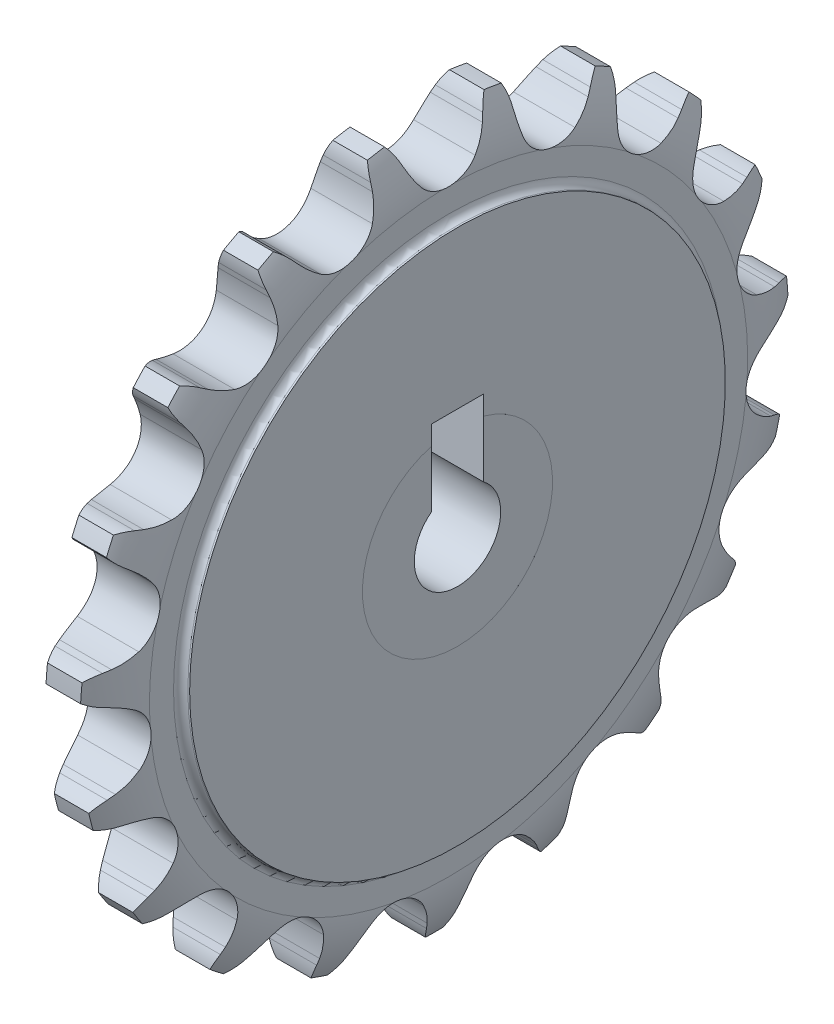
from build123d import *

# Parameters (mm, degrees)
CUT_EXTRUDE_1_DEPTH      = 4.685156443
PATTERN_CIRCULAR_1_COUNT = 19
SKETCH_4_W               = 6
SKETCH_4_H               = 3.260607938
CUT_EXTRUDE_2_DEPTH      = 59.686825317
CHAMFER_1_SIZE           = 1
CHAMFER_2_SIZE           = 1
SKETCH_5_R               = 11
SKETCH_5_R_2             = 5
EXTRUDE_1_DEPTH          = 4.685
CUT_EXTRUDE_3_DEPTH      = 12.37


with BuildPart() as part:
    # 草图1 → 旋转1 (revolve)
    with BuildSketch(Plane.XY):
        with BuildLine():
            Line((-4.685156443, 10), (-4.685156443, 31))
            Line((-4.685156443, 31), (-4.478175154, 31))
            ThreePointArc((-4.478175154, 31), (-3.892743663, 31.242493663), (-3.65025, 31.827925154))
            Line((-3.65025, 31.827925154), (-3.65025, 34.619639763))
            ThreePointArc((-3.65025, 34.619639763), (-3.245836945, 37.918781526), (-1.99925, 41))
            Line((-1.99925, 41), (1.99925, 41))
            ThreePointArc((1.99925, 41), (3.245836945, 37.918781526), (3.65025, 34.619639763))
            Line((3.65025, 34.619639763), (3.65025, 31.827925154))
            ThreePointArc((3.65025, 31.827925154), (3.892743663, 31.242493663), (4.478175154, 31))
            Line((4.478175154, 31), (4.685156443, 31))
            Line((4.685156443, 31), (4.685156443, 10))
            Line((4.685156443, 10), (-4.685156443, 10))
        make_face()
    revolve(axis=Axis((-6.35, 0, 0), (1, 0, 0)))

    # 草图2 → 切除-拉伸1 (cut, symmetric)
    with BuildSketch(Plane(origin=(0, 0, 0), x_dir=(0, 0, -1), z_dir=(1, 0, 0))):
        with BuildLine():
            Line((4.552244709, 38.426451297), (4.858741585, 39.1448403))
            ThreePointArc((4.858741585, 39.1448403), (5.250930322, 39.90290393), (5.750855114, 40.594675334))
            ThreePointArc((5.750855114, 40.594675334), (0, 41), (-5.750855114, 40.594675334))
            ThreePointArc((-5.750855114, 40.594675334), (-5.250930322, 39.90290393), (-4.858741585, 39.1448403))
            Line((-4.858741585, 39.1448403), (-4.552244709, 38.426451297))
            ThreePointArc((-4.552244709, 38.426451297), (-3.937302758, 37.212676935), (-3.168676608, 36.089905522))
            ThreePointArc((-3.168676608, 36.089905522), (0, 34.549839763), (3.168676608, 36.089905522))
            ThreePointArc((3.168676608, 36.089905522), (3.937302758, 37.212676935), (4.552244709, 38.426451297))
        make_face()
    cut_extrude_1 = extrude(amount=CUT_EXTRUDE_1_DEPTH, both=True, mode=Mode.SUBTRACT)

    # 阵列(圆周)1: 切除-拉伸1 ×19 about axis
    pattern_circular_1_axis = Axis((-6.35, 0, 0), (1, 0, 0))
    for i in range(1, PATTERN_CIRCULAR_1_COUNT):
        add(cut_extrude_1.rotate(pattern_circular_1_axis, i * 360 / PATTERN_CIRCULAR_1_COUNT), mode=Mode.SUBTRACT)

    # 草图4 → 切除-拉伸2 (cut, through all)
    with BuildSketch(Plane.ZY.offset(4.685156443)):
        with Locations((0, 11.169695983)):
            Rectangle(SKETCH_4_W, SKETCH_4_H)
    extrude(amount=-CUT_EXTRUDE_2_DEPTH, mode=Mode.SUBTRACT)

    # 倒角1
    chamfer_1_edges = [part.edges().sort_by_distance(p)[0] for p in [
        (-4.685156443, -10, 0),
    ]]
    chamfer(chamfer_1_edges, length=CHAMFER_1_SIZE)

    # 倒角2
    chamfer_2_edges = [part.edges().sort_by_distance(p)[0] for p in [
        (4.685156443, -10, 0),
    ]]
    chamfer(chamfer_2_edges, length=CHAMFER_2_SIZE)

    # 草图5 → 凸台-拉伸1 (add, symmetric)
    with BuildSketch(Plane(origin=(0, 0, 0), x_dir=(0, 0, -1), z_dir=(1, 0, 0))):
        Circle(SKETCH_5_R)
        Circle(SKETCH_5_R_2, mode=Mode.SUBTRACT)
    extrude(amount=EXTRUDE_1_DEPTH, both=True)

    # 草图6 → 切除-拉伸3 (cut)
    with BuildSketch(Plane(origin=(4.685, 0, 0), x_dir=(0, 0, -1), z_dir=(1, 0, 0))):
        Polygon((-3, 12.799999952), (-3, 1.651921097), (3, 4), (3, 12.799999952), align=None)
    extrude(amount=-CUT_EXTRUDE_3_DEPTH, mode=Mode.SUBTRACT)


solid = part.part
